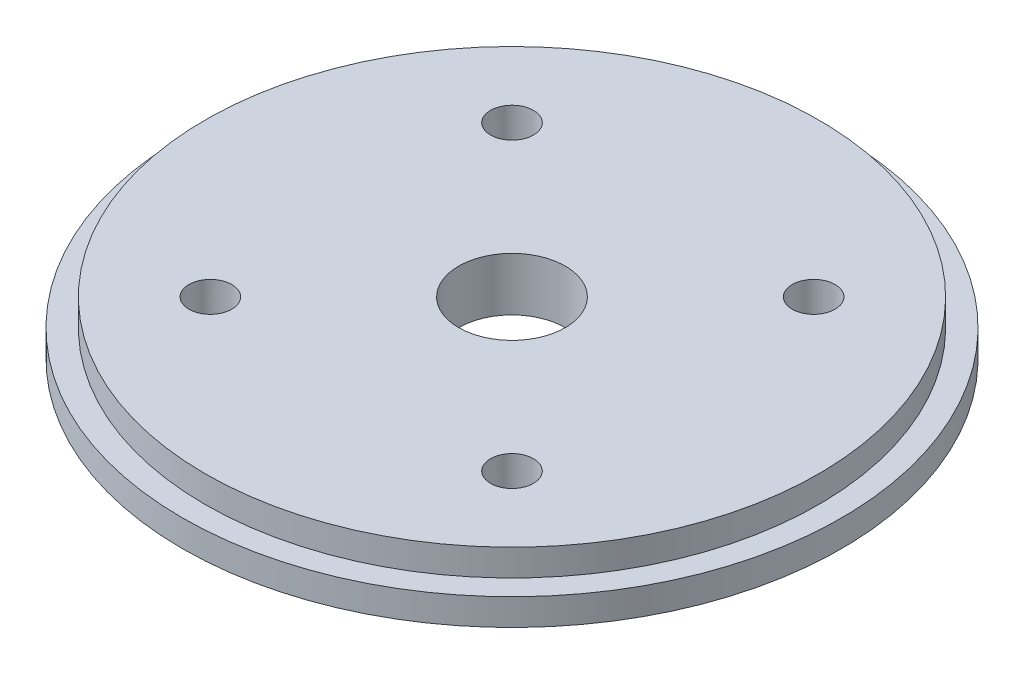
from build123d import *

# Parameters (mm, degrees)
SKETCH2_R                   = 39.243
BOSS_EXTRUDE1_DEPTH         = 6.35
CUT_EXTRUDE1_START          = -3.175
SKETCH4_R                   = 39.243
SKETCH4_R_2                 = 36.5125
CUT_EXTRUDE1_DEPTH          = 3.175
TAP_DRILL_FOR_1_4_20_TAP1_D = 5.1054
F_1_2_0_5_DIAMETER_HOLE1_D  = 12.7
SKETCH9_R                   = 6.35
CUT_EXTRUDE2_DEPTH          = 1.5875


with BuildPart() as part:
    # Sketch2 → Boss-Extrude1 (new body)
    with BuildSketch(Plane(origin=(0, 0, 0), x_dir=(1, 0, 0), z_dir=(0, 1, 0))):
        Circle(SKETCH2_R)
    extrude(amount=BOSS_EXTRUDE1_DEPTH)

    # Sketch4 → Cut-Extrude1 (cut)
    with BuildSketch(Plane(origin=(0, 6.35, 0), x_dir=(1, 0, 0), z_dir=(0, 1, 0)).offset(CUT_EXTRUDE1_START)):
        Circle(SKETCH4_R)
        Circle(SKETCH4_R_2, mode=Mode.SUBTRACT)
    extrude(amount=CUT_EXTRUDE1_DEPTH, mode=Mode.SUBTRACT)

    # Tap Drill for 1/4-20 Tap1 (through all)
    with Locations(Plane(origin=(0, 6.35, 0), x_dir=(1, 0, 0), z_dir=(0, 1, 0))):
        with Locations((-17.960512242, 17.960512242), (-17.960512242, -17.960512242), (17.960512242, 17.960512242), (17.960512242, -17.960512242)):
            Hole(TAP_DRILL_FOR_1_4_20_TAP1_D / 2)

    # 1/2 (0.5) Diameter Hole1 (through all)
    with Locations(Plane(origin=(0, 6.35, 0), x_dir=(1, 0, 0), z_dir=(0, 1, 0))):
        with Locations((0, 0)):
            Hole(F_1_2_0_5_DIAMETER_HOLE1_D / 2)

    # Sketch9 → Cut-Extrude2 (cut)
    with BuildSketch(Plane.XZ):
        with Locations((-17.960512242, 17.960512242)):
            Circle(SKETCH9_R)
        with Locations((17.960512242, 17.960512242)):
            Circle(SKETCH9_R)
        with Locations((17.960512242, -17.960512242)):
            Circle(SKETCH9_R)
        with Locations((-17.960512242, -17.960512242)):
            Circle(SKETCH9_R)
    extrude(amount=-CUT_EXTRUDE2_DEPTH, mode=Mode.SUBTRACT)


solid = part.part
